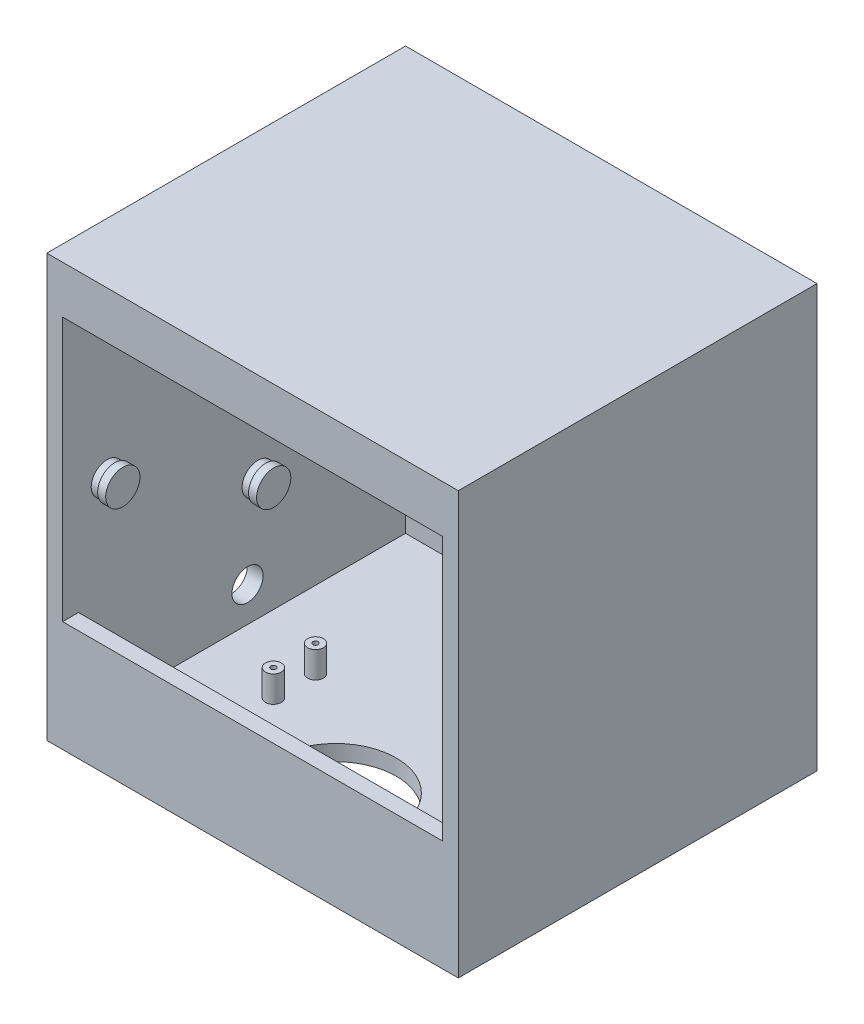
from build123d import *

# Parameters (mm, degrees)
BASE_PLATE_SKETCH_R   = 9.5
BASE_PLATE_SKETCH_R_2 = 3.175
BOSS_EXTRUDE2_DEPTH   = 31.75
BOSS_EXTRUDE2_2_DEPTH = 31.75
BOSS_EXTRUDE2_3_DEPTH = 31.75
BOSS_EXTRUDE2_4_DEPTH = 31.75
SKETCH1_5_W           = 495.3
SKETCH1_5_H           = 431.8
BOSS_EXTRUDE3_DEPTH   = 19.05
SKETCH1_6_R           = 73.025
SKETCH1_6_R_2         = 4.1
SKETCH1_6_R_3         = 4.7625
CUT_EXTRUDE1_DEPTH    = 99.05
SKETCH1_7_W           = 495.3
SKETCH1_7_H           = 431.8
SKETCH1_7_W_2         = 457.2
SKETCH1_7_H_2         = 393.7
BOSS_EXTRUDE4_DEPTH   = 469.9
BACK_WALL_SKETCH_W    = 457.2
BACK_WALL_SKETCH_H    = 152.4
BOSS_EXTRUDE5_DEPTH   = 38.3
BACK_WALL_SKETCH_5_W  = 457.2
BACK_WALL_SKETCH_5_H  = 152.4
CUT_EXTRUDE2_DEPTH    = 19.25
BACK_WALL_SKETCH_7_R  = 16.8
CUT_EXTRUDE5_DEPTH    = 28.875
BACK_WALL_SKETCH_8_R  = 1.875
CUT_EXTRUDE6_DEPTH    = 28.875
LEFT_WALL_SKETCH_R    = 18.75
CUT_EXTRUDE7_DEPTH    = 28.875
LEFT_WALL_SKETCH_3_R  = 19
BOSS_EXTRUDE6_DEPTH   = 9.349994
SKETCH5_R             = 20.6
BOSS_EXTRUDE7_DEPTH   = 9.7
CHAMBER_DOOR_SKETCH_W = 457.2
CHAMBER_DOOR_SKETCH_H = 317.5
CUT_EXTRUDE8_DEPTH    = 25.4
TOP_SKETCH_W          = 495.3
TOP_SKETCH_H          = 431.8
BOSS_EXTRUDE8_DEPTH   = 19.05
BOSS_EXTRUDE9_DEPTH   = 12.7


with BuildPart() as part:
    # Base Plate Sketch → Boss-Extrude2 (new body)
    with BuildSketch(Plane(origin=(0, 0, 0), x_dir=(1, 0, 0), z_dir=(0, 1, 0))):
        with Locations((-84.82915121, 32.220033819)):
            Circle(BASE_PLATE_SKETCH_R)
        with Locations((-84.82915121, 32.220033819)):
            Circle(BASE_PLATE_SKETCH_R_2, mode=Mode.SUBTRACT)
    extrude(amount=BOSS_EXTRUDE2_DEPTH)



with BuildPart() as body_2:
    # Base Plate Sketch → Boss-Extrude2 2 (new body)
    with BuildSketch(Plane(origin=(0, 0, 0), x_dir=(1, 0, 0), z_dir=(0, 1, 0))):
        with Locations((-84.82915121, -18.529928181)):
            Circle(BASE_PLATE_SKETCH_R)
        with Locations((-84.82915121, -18.529928181)):
            Circle(BASE_PLATE_SKETCH_R_2, mode=Mode.SUBTRACT)
    extrude(amount=BOSS_EXTRUDE2_2_DEPTH)


with BuildPart() as body_3:
    # Base Plate Sketch → Boss-Extrude2 3 (new body)
    with BuildSketch(Plane(origin=(0, 0, 0), x_dir=(1, 0, 0), z_dir=(0, 1, 0))):
        with Locations((188.22084879, -18.529928181)):
            Circle(BASE_PLATE_SKETCH_R)
        with Locations((188.22084879, -18.529928181)):
            Circle(BASE_PLATE_SKETCH_R_2, mode=Mode.SUBTRACT)
    extrude(amount=BOSS_EXTRUDE2_3_DEPTH)


with BuildPart() as body_4:
    # Base Plate Sketch → Boss-Extrude2 4 (new body)
    with BuildSketch(Plane(origin=(0, 0, 0), x_dir=(1, 0, 0), z_dir=(0, 1, 0))):
        with Locations((188.22084879, 32.220033819)):
            Circle(BASE_PLATE_SKETCH_R)
        with Locations((188.22084879, 32.220033819)):
            Circle(BASE_PLATE_SKETCH_R_2, mode=Mode.SUBTRACT)
    extrude(amount=BOSS_EXTRUDE2_4_DEPTH)


with BuildPart() as part_1:
    add(part.part)

    add(body_2.part)  # Boss-Extrude3 merges body 2

    add(body_3.part)  # Boss-Extrude3 merges body 3

    add(body_4.part)  # Boss-Extrude3 merges body 4
    # Sketch1<5> → Boss-Extrude3 (add)
    with BuildSketch(Plane(origin=(0, 0, 0), x_dir=(1, 0, 0), z_dir=(0, 1, 0))):
        with Locations((51.69584879, 35.795033019)):
            Rectangle(SKETCH1_5_W, SKETCH1_5_H)
    extrude(amount=-BOSS_EXTRUDE3_DEPTH)

    # Sketch1<6> → Cut-Extrude1 (cut)
    with BuildSketch(Plane(origin=(0, 0, 0), x_dir=(1, 0, 0), z_dir=(0, 1, 0))):
        with Locations((51.69584879, -80.092466981)):
            Circle(SKETCH1_6_R)
        with Locations((-72.12915121, -82.029928181)):
            Circle(SKETCH1_6_R_2)
        with Locations((-72.12915121, 203.670033819)):
            Circle(SKETCH1_6_R_3)
        with Locations((175.52084879, -82.029928181)):
            Circle(SKETCH1_6_R_2)
        with Locations((175.52084879, 203.670033819)):
            Circle(SKETCH1_6_R_3)
    extrude(amount=-CUT_EXTRUDE1_DEPTH, mode=Mode.SUBTRACT)

    # Sketch1<7> → Boss-Extrude4 (add)
    with BuildSketch(Plane(origin=(0, 0, 0), x_dir=(1, 0, 0), z_dir=(0, 1, 0))):
        with Locations((51.69584879, 35.795033019)):
            Rectangle(SKETCH1_7_W, SKETCH1_7_H)
        with Locations((51.69584879, 35.795033019)):
            Rectangle(SKETCH1_7_W_2, SKETCH1_7_H_2, mode=Mode.SUBTRACT)
    extrude(amount=BOSS_EXTRUDE4_DEPTH)

    # Back Wall Sketch → Boss-Extrude5 (add)
    with BuildSketch(Plane.XY.offset(-232.645033019)):
        with Locations((51.69584879, 190.5)):
            Rectangle(BACK_WALL_SKETCH_W, BACK_WALL_SKETCH_H)
    extrude(amount=-BOSS_EXTRUDE5_DEPTH)

    # Back Wall Sketch<5> → Cut-Extrude2 (cut)
    with BuildSketch(Plane.XY.offset(-232.645033019)):
        with Locations((51.69584879, 190.5)):
            Rectangle(BACK_WALL_SKETCH_5_W, BACK_WALL_SKETCH_5_H)
    extrude(amount=-CUT_EXTRUDE2_DEPTH, mode=Mode.SUBTRACT)


with BuildPart() as cut_extrude2_piece_1:
    # of the separate pieces the step leaves, piece 1, a body of its own (cut_extrude2_pieces)
    add(part_1.part.solids().sort_by_distance((-195.95415121, -19.05, -251.695033019))[0])

    # Back Wall Sketch<8> → Cut-Extrude6 (cut)
    with BuildSketch(Plane.XY.offset(-232.645033019)):
        with Locations((-117.971635681, 342.32499988)):
            Circle(BACK_WALL_SKETCH_8_R)
        with Locations((-21.04165115, 294.98749994)):
            Circle(BACK_WALL_SKETCH_8_R)
        with Locations((-117.971635681, 316.57499988)):
            Circle(BACK_WALL_SKETCH_8_R)
        with Locations((124.43334873, 294.98749994)):
            Circle(BACK_WALL_SKETCH_8_R)
        with Locations((221.363333262, 342.32499988)):
            Circle(BACK_WALL_SKETCH_8_R)
        with Locations((221.363333262, 316.57499988)):
            Circle(BACK_WALL_SKETCH_8_R)
    extrude(amount=-CUT_EXTRUDE6_DEPTH, mode=Mode.SUBTRACT)

    # Left Wall Sketch → Cut-Extrude7 (cut)
    with BuildSketch(Plane(origin=(-176.90415121, 0, 0), x_dir=(0, 0, -1), z_dir=(1, 0, 0))):
        with Locations((42.445032419, 41.6100006)):
            Circle(LEFT_WALL_SKETCH_R)
    extrude(amount=-CUT_EXTRUDE7_DEPTH, mode=Mode.SUBTRACT)

    # Left Wall Sketch<3> → Boss-Extrude6 (add)
    with BuildSketch(Plane(origin=(-176.90415121, 0, 0), x_dir=(0, 0, -1), z_dir=(1, 0, 0))):
        with Locations((-126.714166981, 237.439962)):
            Circle(LEFT_WALL_SKETCH_3_R)
        with Locations((54.895071019, 145.999962)):
            Circle(LEFT_WALL_SKETCH_3_R)
    extrude(amount=BOSS_EXTRUDE6_DEPTH)

    # Sketch5 → Boss-Extrude7 (add)
    with BuildSketch(Plane(origin=(-167.55415721, 0, 0), x_dir=(0, 0, -1), z_dir=(1, 0, 0))):
        with Locations((-126.714166981, 237.439962)):
            Circle(SKETCH5_R)
        with Locations((54.895071019, 145.999962)):
            Circle(SKETCH5_R)
    extrude(amount=BOSS_EXTRUDE7_DEPTH)

    # Chamber Door Sketch → Cut-Extrude8 (cut)
    with BuildSketch(Plane(origin=(0, 0, 161.054966981), x_dir=(-1, 0, 0), z_dir=(0, 0, -1))):
        with Locations((-51.69584879, 273.05)):
            Rectangle(CHAMBER_DOOR_SKETCH_W, CHAMBER_DOOR_SKETCH_H)
    extrude(amount=-CUT_EXTRUDE8_DEPTH, mode=Mode.SUBTRACT)

    # Top Sketch → Boss-Extrude8 (add)
    with BuildSketch(Plane(origin=(0, 469.9, 0), x_dir=(1, 0, 0), z_dir=(0, 1, 0))):
        with Locations((51.69584879, 35.795033019)):
            Rectangle(TOP_SKETCH_W, TOP_SKETCH_H)
    extrude(amount=BOSS_EXTRUDE8_DEPTH)

    # Sketch7 → Boss-Extrude9 (add)
    with BuildSketch(Plane.XZ.offset(-469.9)):
        Polygon((22.020139267, -181.825033019), (11.010069633, -162.755033019), (-11.010069633, -162.755033019), (-22.020139267, -181.825033019), (-11.010069633, -200.895033019), (11.010069633, -200.895033019), align=None)
    extrude(amount=BOSS_EXTRUDE9_DEPTH)


with BuildPart() as cut_extrude2_piece_2:
    # of the separate pieces the step leaves, piece 2, a body of its own (cut_extrude2_pieces)
    add(part_1.part.solids().sort_by_distance((-176.90415121, 114.3, -251.895033019))[0])

    # Back Wall Sketch<7> → Cut-Extrude5 (cut)
    with BuildSketch(Plane.XY.offset(-232.645033019)):
        with Locations((184.12128879, 148.2999955)):
            Circle(BACK_WALL_SKETCH_7_R)
    extrude(amount=-CUT_EXTRUDE5_DEPTH, mode=Mode.SUBTRACT)


solid = Compound([cut_extrude2_piece_1.part, cut_extrude2_piece_2.part])
